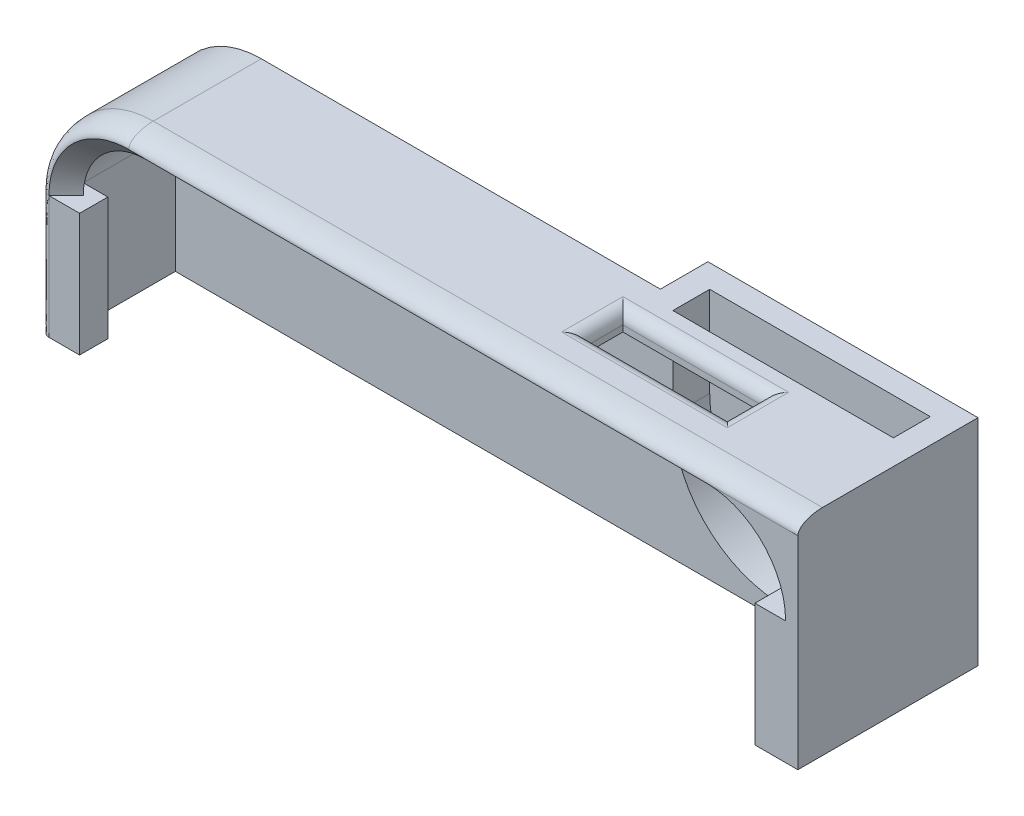
from build123d import *

# Parameters (mm, degrees)
BOSS_EXTRUDE1_DEPTH  = 10.8
BOSS_EXTRUDE2_DEPTH  = 1
SKETCH3_W            = 2
SKETCH3_H            = 10
BOSS_EXTRUDE3_DEPTH  = 2.3
FILLET1_SIZE         = 2
FILLET1_SIZE_2       = 1
CUT_EXTRUDE1_REACH   = 67.321
SKETCH4_W            = 11.5
SKETCH4_H            = 3
BOSS_EXTRUDE4_DEPTH  = 2.3
CHAMFER1_SIZE        = 1.5
CUT_EXTRUDE2_DEPTH   = 2
BOSS_EXTRUDE6_DEPTH  = 2
FILLET2_R            = 1
BOSS_EXTRUDE36_DEPTH = 1
BOSS_EXTRUDE7_DEPTH  = 1.87
SKETCH11_R           = 2.5
CUT_EXTRUDE3_DEPTH   = 66.681732761


with BuildPart() as part:
    # Sketch1 → Boss-Extrude1 (new body)
    with BuildSketch(Plane.XY):
        with BuildLine():
            ThreePointArc((7.5, 17.5), (2.196699141, 15.303300859), (0, 10))
            Line((0, 10), (0, 0))
            Line((0, 0), (1.5, 0))
            Line((1.5, 0), (1.5, 10))
            ThreePointArc((1.5, 10), (3.257359313, 14.242640687), (7.5, 16))
            Line((7.5, 16), (54.5, 16))
            ThreePointArc((54.5, 16), (58.742640687, 14.242640687), (60.5, 10))
            Line((60.5, 10), (60.5, 0))
            Line((60.5, 0), (62, 0))
            Line((62, 0), (62, 17.5))
            Line((62, 17.5), (7.5, 17.5))
        make_face()
    extrude(amount=BOSS_EXTRUDE1_DEPTH)


with BuildPart() as body_2:
    # Sketch2 → Boss-Extrude2 (new body)
    with BuildSketch(Plane(origin=(0, 0, 0), x_dir=(-1, 0, 0), z_dir=(0, 0, -1))):
        with BuildLine():
            Line((-1.5, 0), (-1.5, 10))
            ThreePointArc((-1.5, 10), (-3.257359313, 14.242640687), (-7.5, 16))
            Line((-7.5, 16), (-54.5, 16))
            ThreePointArc((-54.5, 16), (-58.742640687, 14.242640687), (-60.5, 10))
            Line((-60.5, 10), (-60.5, 0))
            Line((-60.5, 0), (-1.5, 0))
        make_face()
    extrude(amount=-BOSS_EXTRUDE2_DEPTH)

    # Combine1: union part
    add(part.part)

    # Sketch3 → Boss-Extrude3 (add)
    with BuildSketch(Plane.XY.offset(10.8)):
        with Locations((2.5, 5)):
            Rectangle(SKETCH3_W, SKETCH3_H)
        with Locations((59.5, 5)):
            Rectangle(SKETCH3_W, SKETCH3_H)
    extrude(amount=-BOSS_EXTRUDE3_DEPTH)

    # Fillet1
    # a fillet whose section is not a circle: 2, 1 mm, written as the material it takes off along each edge
    with BuildSketch(Plane(origin=(0, 10, 10.8), x_dir=(0, 0, -1), z_dir=(0, -1, 0))) as fillet1_piece_1:
        with BuildLine():
            Bezier((FILLET1_SIZE, 0), (0, 0), (0, FILLET1_SIZE_2), weights=[1, 0.707106781, 1])
            Line((0, FILLET1_SIZE_2), (0, 0))
            Line((0, 0), (FILLET1_SIZE, 0))
        make_face()
    extrude(amount=15, mode=Mode.SUBTRACT)
    with BuildSketch(Plane(origin=(7.5, 10, 10.8), x_dir=(0, 1, 0), z_dir=(1, 0, 0))) as fillet1_piece_2:
        with BuildLine():
            Bezier((7.5, -FILLET1_SIZE), (7.5, 0), (7.5 - FILLET1_SIZE_2, 0), weights=[1, 0.707106781, 1])
            Line((7.5 - FILLET1_SIZE_2, 0), (7.5, 0))
            Line((7.5, 0), (7.5, -FILLET1_SIZE))
        make_face()
    revolve(axis=Axis((7.5, 10, 10.8), (0, 0, 1)), revolution_arc=90, mode=Mode.SUBTRACT)
    with BuildSketch(Plane(origin=(67, 17.5, 10.8), x_dir=(0, 0, -1), z_dir=(-1, 0, 0))) as fillet1_piece_3:
        with BuildLine():
            Bezier((FILLET1_SIZE, 0), (0, 0), (0, FILLET1_SIZE_2), weights=[1, 0.707106781, 1])
            Line((0, FILLET1_SIZE_2), (0, 0))
            Line((0, 0), (FILLET1_SIZE, 0))
        make_face()
    extrude(amount=59.5, mode=Mode.SUBTRACT)

    # Sketch4 → Cut-Extrude1 (cut, up to next)
    with BuildSketch(Plane(origin=(0, 17.5, 0), x_dir=(1, 0, 0), z_dir=(0, 1, 0)), mode=Mode.PRIVATE) as cut_extrude1_sk1:
        with Locations((45.75, -4.55)):
            Rectangle(SKETCH4_W, SKETCH4_H)
    cut_extrude1_tool1 = extrude(cut_extrude1_sk1.sketch, amount=-CUT_EXTRUDE1_REACH, mode=Mode.PRIVATE) & body_2.part
    add(cut_extrude1_tool1.solids().sort_by_distance((45.75, 17.5, 4.55))[0], mode=Mode.SUBTRACT)

    # Sketch5 → Boss-Extrude4 (add)
    with BuildSketch(Plane.XY.offset(10.8)):
        with BuildLine():
            Line((60.5, 10), (59.5, 10))
            ThreePointArc((59.5, 10), (58.035533906, 13.535533906), (54.5, 15))
            Line((54.5, 15), (7.5, 15))
            ThreePointArc((7.5, 15), (3.964466094, 13.535533906), (2.5, 10))
            Line((2.5, 10), (1.5, 10))
            ThreePointArc((1.5, 10), (3.257359313, 14.242640687), (7.5, 16))
            Line((7.5, 16), (54.5, 16))
            ThreePointArc((54.5, 16), (58.742640687, 14.242640687), (60.5, 10))
        make_face()
    extrude(amount=-BOSS_EXTRUDE4_DEPTH)

    # Chamfer1
    chamfer1_edges = [body_2.edges().sort_by_distance(p)[0] for p in [
        (58.035533906, 13.535533906, 10.8),
        (3.964466094, 13.535533906, 10.8),
        (31, 15, 10.8),
    ]]
    chamfer(chamfer1_edges, length=CHAMFER1_SIZE - 0.0001)  # a hair under: the kernel refuses the full size

    # Chamfer3: read off the stored shape, not the designer's step
    # Chamfer3: loft between two sections, ruled curve by curve
    chamfer3_from = [
        Edge.make_three_point_arc((2.4, 10, 9.4), (3.893755416, 13.606244584, 9.4), (7.5, 15.1, 9.4)),
        Edge.make_three_point_arc((54.5, 15.1, 9.4), (58.106244584, 13.606244584, 9.4), (59.6, 10, 9.4)),
        Edge.make_line((7.5, 15.1, 9.4), (54.5, 15.1, 9.4)),
        Edge.make_line((59.6, 10, 9.4), (2.4, 10, 9.4)),
    ]
    chamfer3_to = [
        Edge.make_three_point_arc((1.5, 10, 8.5), (3.257359313, 14.242640687, 8.5), (7.5, 16, 8.5)),
        Edge.make_three_point_arc((54.5, 16, 8.5), (58.742640687, 14.242640687, 8.5), (60.5, 10, 8.5)),
        Edge.make_line((7.5, 16, 8.5), (54.5, 16, 8.5)),
        Edge.make_line((60.5, 10, 8.5), (1.5, 10, 8.5)),
    ]
    chamfer3 = Solid(Shell([*[Face.make_surface_from_curves(chamfer3_from[k], chamfer3_to[k]) for k in range(4)], Face(Wire(chamfer3_from)), Face(Wire(chamfer3_to))]))
    add(chamfer3, mode=Mode.SUBTRACT)

    # Sketch6 → Cut-Extrude2 (cut)
    with BuildSketch(Plane(origin=(0, 0, 0), x_dir=(-1, 0, 0), z_dir=(0, 0, -1))):
        with BuildLine():
            Line((-59.98, 10.15), (-59.98, 16.85))
            Line((-59.98, 16.85), (-59.98, 17.5))
            Line((-59.98, 17.5), (-42.02, 17.5))
            Line((-42.02, 17.5), (-42.02, 16.85))
            Line((-42.02, 16.85), (-42.02, 10.15))
            ThreePointArc((-42.02, 10.15), (-51, 1.17), (-59.98, 10.15))
        make_face()
    extrude(amount=-CUT_EXTRUDE2_DEPTH, mode=Mode.SUBTRACT)

    # Sketch9 → Boss-Extrude6 (add)
    with BuildSketch(Plane(origin=(0, 0, 0), x_dir=(-1, 0, 0), z_dir=(0, 0, -1))):
        with BuildLine():
            Line((-54.5, 0), (-62, 0))
            Line((-62, 0), (-62, 6.85))
            Line((-62, 6.85), (-62, 17.5))
            Line((-62, 17.5), (-59.98, 17.5))
            Line((-59.98, 17.5), (-59.98, 10.15))
            ThreePointArc((-59.98, 10.15), (-51, 1.17), (-42.02, 10.15))
            Line((-42.02, 10.15), (-42.02, 17.5))
            Line((-42.02, 17.5), (-40, 17.5))
            Line((-40, 17.5), (-40, 6.854472052))
            Line((-40, 6.854472052), (-40, 0))
            Line((-40, 0), (-47.292116273, 0))
            Line((-47.292116273, 0), (-54.5, 0))
        make_face()
    extrude(amount=BOSS_EXTRUDE6_DEPTH)

    # Fillet2
    fillet2_edges = [body_2.edges().sort_by_distance(p)[0] for p in [
        (51.5, 17.5, 4.55),
        (45.75, 17.5, 3.05),
        (40, 17.5, 4.55),
        (45.75, 17.5, 6.05),
    ]]
    fillet(fillet2_edges, radius=FILLET2_R)

    # Sketch48 → Boss-Extrude36 (add)
    with BuildSketch(Plane(origin=(0, 0, 2), x_dir=(-1, 0, 0), z_dir=(0, 0, -1))):
        with BuildLine():
            Line((-54.5, 16), (-42.02, 16))
            Line((-42.02, 16), (-42.02, 17.5))
            Line((-42.02, 17.5), (-59.98, 17.5))
            Line((-59.98, 17.5), (-59.98, 12.443276489))
            ThreePointArc((-59.98, 12.443276489), (-57.766522698, 15.032874871), (-54.5, 16))
        make_face()
    extrude(amount=BOSS_EXTRUDE36_DEPTH)

    # Sketch10 → Boss-Extrude7 (add)
    with BuildSketch(Plane(origin=(0, 0, -2), x_dir=(-1, 0, 0), z_dir=(0, 0, -1))):
        Polygon((-54.5, 0), (-62, 0), (-62, 3.4), (-62, 17.5), (-40, 17.5), (-40, 6.854472052), (-40, 0), (-47.292116273, 0), align=None)
    extrude(amount=BOSS_EXTRUDE7_DEPTH)

    # Sketch11 → Cut-Extrude3 (cut, through all)
    with BuildSketch(Plane.XY.offset(-2)):
        with Locations((51, 8.65)):
            Circle(SKETCH11_R)
    extrude(amount=-CUT_EXTRUDE3_DEPTH, mode=Mode.SUBTRACT)


solid = body_2.part
